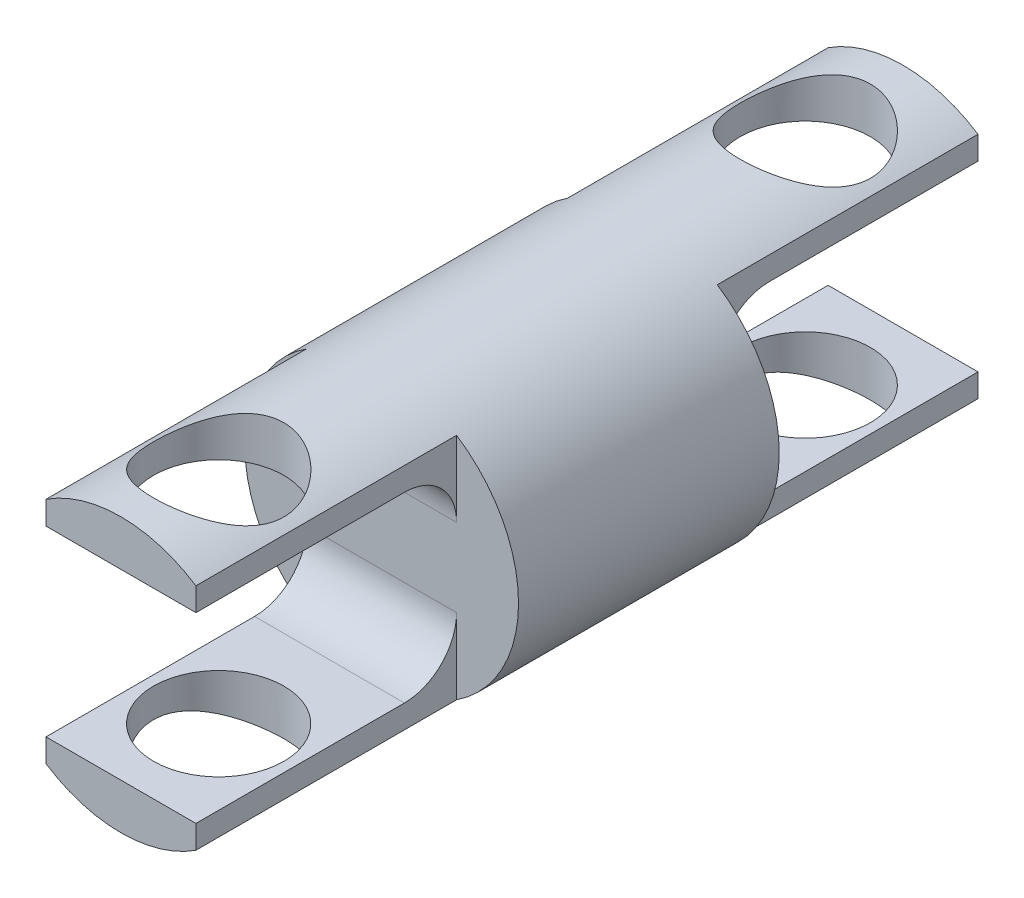
from build123d import *

# Parameters (mm, degrees)
SZKIC1_R                               = 21
DODANIE_WYCI_GNI_CIE1_DEPTH            = 20
DODANIE_WYCI_GNI_CIE4_DEPTH            = 40
SZKIC7_R                               = 10
WYTNIJ_WYCI_GNI_CIE1_DEPTH             = 40
WYTNIJ_WYCI_GNI_CIE1_DIRECTION_2_REACH = 74.567
ZAOKR_GLENIE1_R                        = 8
ZAOKR_GLENIE1_OF_LUSTRO2_R             = 8


with BuildPart() as part:
    # Szkic1 → Dodanie-wyciągnięcie1 (new body)
    with BuildSketch(Plane.XY):
        Circle(SZKIC1_R)
    dodanie_wyci_gni_cie1 = extrude(amount=DODANIE_WYCI_GNI_CIE1_DEPTH)

    # Szkic6 → Dodanie-wyciągnięcie4 (add)
    with BuildSketch(Plane.XY.offset(20)):
        with BuildLine():
            Line((-11.5, 17.571283391), (-11.5, 14))
            Line((-11.5, 14), (11.5, 14))
            Line((11.5, 14), (11.5, 17.571283391))
            ThreePointArc((11.5, 17.571283391), (0, 21), (-11.5, 17.571283391))
        make_face()
        with BuildLine():
            Line((11.5, -14), (11.5, -17.571283391))
            ThreePointArc((11.5, -17.571283391), (0, -21), (-11.5, -17.571283391))
            Line((-11.5, -17.571283391), (-11.5, -14))
            Line((-11.5, -14), (11.5, -14))
        make_face()
    dodanie_wyci_gni_cie4 = extrude(amount=DODANIE_WYCI_GNI_CIE4_DEPTH)

    # Szkic7 → Wytnij-wyciągnięcie1 (cut)
    with BuildSketch(Plane(origin=(0, -14, 0), x_dir=(1, 0, 0), z_dir=(0, 1, 0))):
        with Locations((0, -45)):
            Circle(SZKIC7_R)
    wytnij_wyci_gni_cie1 = extrude(amount=WYTNIJ_WYCI_GNI_CIE1_DEPTH, mode=Mode.SUBTRACT)

    # Szkic7 → Wytnij-wyciągnięcie1 direction 2 (cut, up to next)
    with BuildSketch(Plane(origin=(0, -14, 0), x_dir=(1, 0, 0), z_dir=(0, 1, 0)), mode=Mode.PRIVATE) as wytnij_wyci_gni_cie1_direction_2_sk1:
        with Locations((0, -45)):
            Circle(SZKIC7_R)
    wytnij_wyci_gni_cie1_direction_2_tool1 = extrude(wytnij_wyci_gni_cie1_direction_2_sk1.sketch, amount=-WYTNIJ_WYCI_GNI_CIE1_DIRECTION_2_REACH, mode=Mode.PRIVATE) & part.part
    wytnij_wyci_gni_cie1_direction_2 = wytnij_wyci_gni_cie1_direction_2_tool1.solids().sort_by_distance((0, -14, 45))[0]
    add(wytnij_wyci_gni_cie1_direction_2, mode=Mode.SUBTRACT)

    # Zaokrąglenie1
    zaokr_glenie1_edges = [part.edges().sort_by_distance(p)[0] for p in [
        (0, -14, 20),
        (0, 14, 20),
    ]]
    fillet(zaokr_glenie1_edges, radius=ZAOKR_GLENIE1_R)

    # Lustro2: Dodanie-wyciągnięcie1, Dodanie-wyciągnięcie4, Wytnij-wyciągnięcie1, Wytnij-wyciągnięcie1 direction 2 across plane
    add(dodanie_wyci_gni_cie1.mirror(Plane.XY))
    add(dodanie_wyci_gni_cie4.mirror(Plane.XY))
    add(wytnij_wyci_gni_cie1.mirror(Plane.XY), mode=Mode.SUBTRACT)
    add(wytnij_wyci_gni_cie1_direction_2.mirror(Plane.XY), mode=Mode.SUBTRACT)

    # Zaokrąglenie1 of Lustro2
    zaokr_glenie1_of_lustro2_edges = [part.edges().sort_by_distance(p)[0] for p in [
        (0, -14, -20),
        (0, 14, -20),
    ]]
    fillet(zaokr_glenie1_of_lustro2_edges, radius=ZAOKR_GLENIE1_OF_LUSTRO2_R)


solid = part.part
